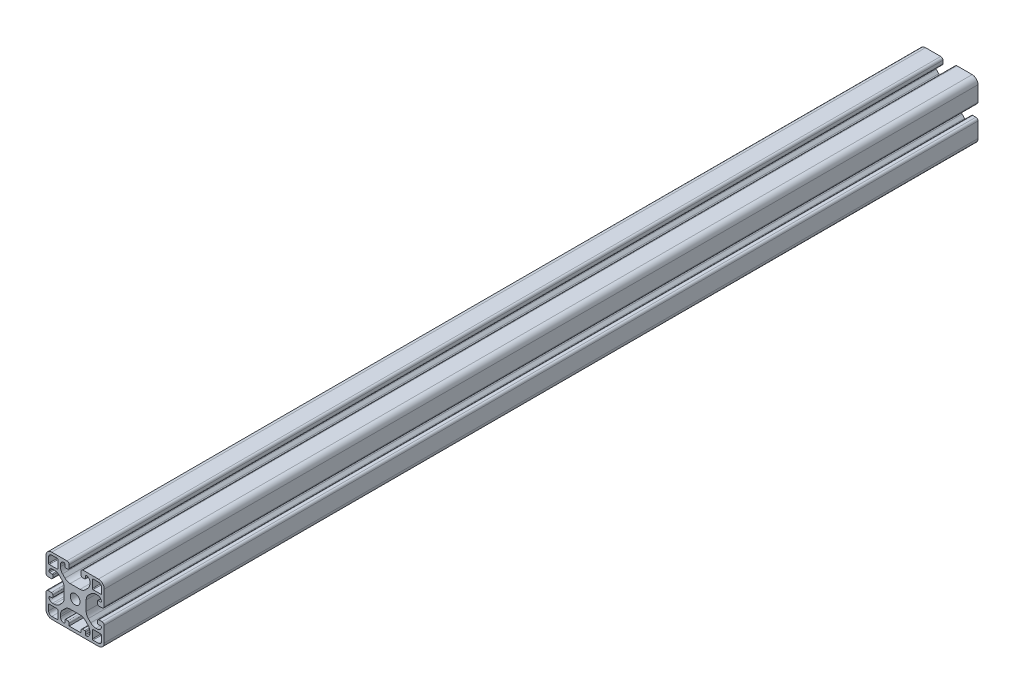
from build123d import *

# Parameters (mm, degrees)
SKIZZE1_R                       = 3.35
AUFSATZ_LINEAR_AUSTRAGEN1_DEPTH = 600
M3_START                        = 1.9e-08
M3_GEWINDEBOHRUNG1_OUTLINE_R    = 1.25
M3_GEWINDEBOHRUNG1_DEPTH        = 27.59999999


# Read off the part's stored shape, not the designer's step: M3 Gewindebohrung1
with BuildPart() as part:
    # Skizze1 → Aufsatz-Linear austragen1 (new body)
    with BuildSketch(Plane.XY.offset(1000)):
        with BuildLine():
            Line((5.899999985, 34.292388165), (5.899999985, 35.500000003))
            ThreePointArc((5.899999985, 35.500000003), (6.632233037, 37.267766961), (8.399999999, 38.000000003))
            ThreePointArc((8.399999999, 38.000000003), (8.753553388, 37.853553393), (8.899999996, 37.500000003))
            Line((8.899999996, 37.500000003), (8.899999996, 35.850000004))
            ThreePointArc((8.899999996, 35.850000004), (9.046446605, 35.496446613), (9.399999996, 35.350000004))
            Line((9.399999996, 35.350000004), (10.899999947, 35.350000004))
            ThreePointArc((10.899999947, 35.350000004), (11.607106728, 35.642893223), (11.899999947, 36.350000004))
            Line((11.899999947, 36.350000004), (11.899999947, 38.500000016))
            ThreePointArc((11.899999947, 38.500000016), (11.460660119, 39.560660188), (10.399999947, 40.000000016))
            Line((10.399999947, 40.000000016), (5.2e-08, 40.000000016))
            ThreePointArc((5.2e-08, 40.000000016), (-2.828427117, 38.828427123), (-4.000000011, 35.999999954))
            Line((-4.000000011, 35.999999954), (-4.000000011, 25.599999996))
            ThreePointArc((-4.000000011, 25.599999996), (-3.560660183, 24.539339825), (-2.500000012, 24.099999997))
            Line((-2.500000012, 24.099999997), (-0.350000011, 24.099999997))
            ThreePointArc((-0.350000011, 24.099999997), (0.35710677, 24.392893216), (0.649999989, 25.099999997))
            Line((0.649999989, 25.099999997), (0.649999989, 26.599999997))
            ThreePointArc((0.649999989, 26.599999997), (0.50355338, 26.953553387), (0.149999989, 27.099999997))
            Line((0.149999989, 27.099999997), (-1.500000011, 27.099999997))
            ThreePointArc((-1.500000011, 27.099999997), (-1.853553401, 27.246446605), (-2.000000011, 27.599999993))
            ThreePointArc((-2.000000011, 27.599999993), (-1.26776697, 29.367766957), (0.499999989, 30.10000001))
            Line((0.499999989, 30.10000001), (1.707611833, 30.10000001))
            ThreePointArc((1.707611833, 30.10000001), (3.621028995, 29.719397673), (5.243145739, 28.635533916))
            Line((5.243145739, 28.635533916), (6.935533894, 26.943145761))
            ThreePointArc((6.935533894, 26.943145761), (8.01939765, 25.321029017), (8.399999988, 23.407611855))
            Line((8.399999988, 23.407611855), (8.399999988, 16.592388122))
            ThreePointArc((8.399999988, 16.592388122), (8.01939765, 14.678970961), (6.935533894, 13.056854217))
            Line((6.935533894, 13.056854217), (5.243145737, 11.36446606))
            ThreePointArc((5.243145737, 11.36446606), (3.621028993, 10.280602303), (1.707611831, 9.899999966))
            Line((1.707611831, 9.899999966), (0.49999999, 9.899999966))
            ThreePointArc((0.49999999, 9.899999966), (-1.267766968, 10.632233018), (-2.00000001, 12.399999979))
            ThreePointArc((-2.00000001, 12.399999979), (-1.8535534, 12.753553368), (-1.50000001, 12.899999977))
            Line((-1.50000001, 12.899999977), (0.149999989, 12.899999977))
            ThreePointArc((0.149999989, 12.899999977), (0.50355338, 13.046446586), (0.649999989, 13.399999977))
            Line((0.649999989, 13.399999977), (0.649999989, 14.899999976))
            ThreePointArc((0.649999989, 14.899999976), (0.35710677, 15.607106757), (-0.350000011, 15.899999976))
            Line((-0.350000011, 15.899999976), (-2.50000001, 15.899999976))
            ThreePointArc((-2.50000001, 15.899999976), (-3.560660182, 15.460660148), (-4.000000011, 14.399999976))
            Line((-4.000000011, 14.399999976), (-4.000000011, 4.000000069))
            ThreePointArc((-4.000000011, 4.000000069), (-2.828427121, 1.171572909), (4e-08, 1.9e-08))
            Line((4e-08, 1.9e-08), (31.999999925, 1.9e-08))
            ThreePointArc((31.999999925, 1.9e-08), (34.828427086, 1.171572909), (35.999999976, 4.00000007))
            Line((35.999999976, 4.00000007), (35.999999976, 14.399999977))
            ThreePointArc((35.999999976, 14.399999977), (35.560660149, 15.460660148), (34.499999978, 15.899999976))
            Line((34.499999978, 15.899999976), (32.349999991, 15.899999976))
            ThreePointArc((32.349999991, 15.899999976), (31.642893209, 15.607106757), (31.34999999, 14.899999976))
            Line((31.34999999, 14.899999976), (31.34999999, 13.399999977))
            ThreePointArc((31.34999999, 13.399999977), (31.4964466, 13.046446586), (31.84999999, 12.899999977))
            Line((31.84999999, 12.899999977), (33.499999991, 12.899999977))
            ThreePointArc((33.499999991, 12.899999977), (33.853553381, 12.753553368), (33.999999991, 12.399999979))
            ThreePointArc((33.999999991, 12.399999979), (33.267766949, 10.632233018), (31.499999991, 9.899999966))
            Line((31.499999991, 9.899999966), (30.292388185, 9.899999966))
            ThreePointArc((30.292388185, 9.899999966), (28.378971023, 10.280602303), (26.756854279, 11.36446606))
            Line((26.756854279, 11.36446606), (25.064466082, 13.056854257))
            ThreePointArc((25.064466082, 13.056854257), (23.980602325, 14.678971001), (23.599999988, 16.592388163))
            Line((23.599999988, 16.592388163), (23.599999988, 23.407611842))
            ThreePointArc((23.599999988, 23.407611842), (23.980602325, 25.321029004), (25.064466082, 26.943145747))
            Line((25.064466082, 26.943145747), (26.75685425, 28.635533916))
            ThreePointArc((26.75685425, 28.635533916), (28.378970995, 29.719397673), (30.292388156, 30.10000001))
            Line((30.292388156, 30.10000001), (31.499999989, 30.10000001))
            ThreePointArc((31.499999989, 30.10000001), (33.267766948, 29.367766957), (33.999999989, 27.599999993))
            ThreePointArc((33.999999989, 27.599999993), (33.853553379, 27.246446605), (33.499999989, 27.099999997))
            Line((33.499999989, 27.099999997), (31.84999999, 27.099999997))
            ThreePointArc((31.84999999, 27.099999997), (31.4964466, 26.953553387), (31.34999999, 26.599999997))
            Line((31.34999999, 26.599999997), (31.34999999, 25.099999997))
            ThreePointArc((31.34999999, 25.099999997), (31.642893209, 24.392893216), (32.34999999, 24.099999997))
            Line((32.34999999, 24.099999997), (34.499999976, 24.099999997))
            ThreePointArc((34.499999976, 24.099999997), (35.560660148, 24.539339825), (35.999999976, 25.599999997))
            Line((35.999999976, 25.599999997), (35.999999976, 35.999999953))
            ThreePointArc((35.999999976, 35.999999953), (34.828427083, 38.828427123), (31.999999914, 40.000000016))
            Line((31.999999914, 40.000000016), (21.600000015, 40.000000016))
            ThreePointArc((21.600000015, 40.000000016), (20.539339844, 39.560660188), (20.100000016, 38.500000017))
            Line((20.100000016, 38.500000017), (20.100000016, 36.350000004))
            ThreePointArc((20.100000016, 36.350000004), (20.392893235, 35.642893223), (21.100000017, 35.350000004))
            Line((21.100000017, 35.350000004), (22.600000014, 35.350000004))
            ThreePointArc((22.600000014, 35.350000004), (22.953553405, 35.496446613), (23.100000014, 35.850000004))
            Line((23.100000014, 35.850000004), (23.100000014, 37.500000007))
            ThreePointArc((23.100000014, 37.500000007), (23.246446625, 37.8535534), (23.600000019, 38.000000007))
            ThreePointArc((23.600000019, 38.000000007), (25.367766955, 37.267766951), (26.099999992, 35.500000007))
            Line((26.099999992, 35.500000007), (26.099999992, 34.292388127))
            ThreePointArc((26.099999992, 34.292388127), (25.719397655, 32.378970966), (24.635533898, 30.756854221))
            Line((24.635533898, 30.756854221), (22.943145779, 29.064466103))
            ThreePointArc((22.943145779, 29.064466103), (21.321029035, 27.980602346), (19.407611873, 27.600000009))
            Line((19.407611873, 27.600000009), (12.592388142, 27.600000009))
            ThreePointArc((12.592388142, 27.600000009), (10.678970981, 27.980602346), (9.056854237, 29.064466102))
            Line((9.056854237, 29.064466102), (7.36446608, 30.75685426))
            ThreePointArc((7.36446608, 30.75685426), (6.280602323, 32.378971004), (5.899999985, 34.292388165))
        make_face()
        with Locations(Location((15.999999985, 20, 0), (0, 0, 180))):
            Circle(SKIZZE1_R, mode=Mode.SUBTRACT)
        with BuildLine():
            Line((27.799999996, 32.299999708), (27.799999996, 37.700000083))
            ThreePointArc((27.799999996, 37.700000083), (27.946446591, 38.053553439), (28.299999947, 38.200000034))
            Line((28.299999947, 38.200000034), (31.999999914, 38.200000034))
            ThreePointArc((31.999999914, 38.200000034), (33.555634889, 37.555634929), (34.199999994, 35.999999953))
            Line((34.199999994, 35.999999953), (34.199999994, 32.300000046))
            ThreePointArc((34.199999994, 32.300000046), (34.053553382, 31.946446648), (33.699999983, 31.800000035))
            Line((33.699999983, 31.800000035), (28.299999669, 31.800000035))
            ThreePointArc((28.299999669, 31.800000035), (27.94644651, 31.946446549), (27.799999996, 32.299999708))
        make_face(mode=Mode.SUBTRACT)
        with BuildLine():
            Line((28.299999669, 8.199999998), (33.700000043, 8.199999998))
            ThreePointArc((33.700000043, 8.199999998), (34.053553399, 8.053553402), (34.199999994, 7.700000046))
            Line((34.199999994, 7.700000046), (34.199999994, 4.00000007))
            ThreePointArc((34.199999994, 4.00000007), (33.555634893, 2.444365103), (31.999999925, 1.800000001))
            Line((31.999999925, 1.800000001), (28.300000007, 1.800000001))
            ThreePointArc((28.300000007, 1.800000001), (27.946446609, 1.946446613), (27.799999996, 2.300000012))
            Line((27.799999996, 2.300000012), (27.799999996, 7.700000324))
            ThreePointArc((27.799999996, 7.700000324), (27.94644651, 8.053553484), (28.299999669, 8.199999998))
        make_face(mode=Mode.SUBTRACT)
        with BuildLine():
            Line((3.700000285, 31.800000035), (-1.700000077, 31.800000035))
            ThreePointArc((-1.700000077, 31.800000035), (-2.053553433, 31.94644663), (-2.200000029, 32.299999986))
            Line((-2.200000029, 32.299999986), (-2.200000029, 35.999999954))
            ThreePointArc((-2.200000029, 35.999999954), (-1.555634924, 37.555634929), (5.2e-08, 38.200000034))
            Line((5.2e-08, 38.200000034), (3.699999947, 38.200000034))
            ThreePointArc((3.699999947, 38.200000034), (4.053553346, 38.053553422), (4.199999959, 37.700000023))
            Line((4.199999959, 37.700000023), (4.199999959, 32.299999708))
            ThreePointArc((4.199999959, 32.299999708), (4.053553445, 31.946446549), (3.700000285, 31.800000035))
        make_face(mode=Mode.SUBTRACT)
        with BuildLine():
            Line((4.199999959, 7.700000324), (4.199999959, 2.299999952))
            ThreePointArc((4.199999959, 2.299999952), (4.053553363, 1.946446596), (3.700000007, 1.800000001))
            Line((3.700000007, 1.800000001), (4e-08, 1.800000001))
            ThreePointArc((4e-08, 1.800000001), (-1.555634927, 2.444365102), (-2.200000029, 4.000000069))
            Line((-2.200000029, 4.000000069), (-2.200000029, 7.699999986))
            ThreePointArc((-2.200000029, 7.699999986), (-2.053553416, 8.053553385), (-1.700000017, 8.199999998))
            Line((-1.700000017, 8.199999998), (3.700000285, 8.199999998))
            ThreePointArc((3.700000285, 8.199999998), (4.053553445, 8.053553484), (4.199999959, 7.700000324))
        make_face(mode=Mode.SUBTRACT)
        with BuildLine():
            Line((20.100000016, 2.000000008), (11.899999947, 2.000000008))
            Line((11.899999947, 2.000000008), (11.899999947, 3.649999992))
            ThreePointArc((11.899999947, 3.649999992), (11.607106728, 4.357106773), (10.899999947, 4.649999992))
            Line((10.899999947, 4.649999992), (9.399999996, 4.649999992))
            ThreePointArc((9.399999996, 4.649999992), (9.046446606, 4.503553382), (8.899999996, 4.149999992))
            Line((8.899999996, 4.149999992), (8.899999996, 2.499999991))
            ThreePointArc((8.899999996, 2.499999991), (8.753553389, 2.146446604), (8.400000003, 1.999999994))
            ThreePointArc((8.400000003, 1.999999994), (6.632233039, 2.732233035), (5.899999985, 4.499999994))
            Line((5.899999985, 4.499999994), (5.899999985, 5.707611838))
            ThreePointArc((5.899999985, 5.707611838), (6.280602323, 7.621029001), (7.36446608, 9.243145746))
            Line((7.36446608, 9.243145746), (9.056854238, 10.935533903))
            ThreePointArc((9.056854238, 10.935533903), (10.678970982, 12.01939766), (12.592388143, 12.399999997))
            Line((12.592388143, 12.399999997), (19.407611847, 12.399999997))
            ThreePointArc((19.407611847, 12.399999997), (21.321029008, 12.01939766), (22.943145752, 10.935533904))
            Line((22.943145752, 10.935533904), (24.635533898, 9.243145757))
            ThreePointArc((24.635533898, 9.243145757), (25.719397655, 7.621029013), (26.099999992, 5.707611851))
            Line((26.099999992, 5.707611851), (26.099999992, 4.499999993))
            ThreePointArc((26.099999992, 4.499999993), (25.367766954, 2.73223305), (23.600000019, 1.999999995))
            ThreePointArc((23.600000019, 1.999999995), (23.246446625, 2.146446603), (23.100000014, 2.499999995))
            Line((23.100000014, 2.499999995), (23.100000014, 4.149999994))
            ThreePointArc((23.100000014, 4.149999994), (22.953553405, 4.503553383), (22.600000016, 4.649999992))
            Line((22.600000016, 4.649999992), (21.100000017, 4.649999992))
            ThreePointArc((21.100000017, 4.649999992), (20.392893235, 4.357106773), (20.100000016, 3.649999992))
            Line((20.100000016, 3.649999992), (20.100000016, 2.000000008))
        make_face(mode=Mode.SUBTRACT)
    extrude(amount=-AUFSATZ_LINEAR_AUSTRAGEN1_DEPTH)

    # M3 Gewindebohrung1 outline → M3 Gewindebohrung1 (cut)
    with BuildSketch(Plane(origin=(0, 0, 0), x_dir=(1, 0, 0), z_dir=(0, 1, 0)).offset(M3_START)):
        with Locations((15.999999982, -450)):
            Circle(M3_GEWINDEBOHRUNG1_OUTLINE_R)
        with Locations((15.999999982, -475)):
            Circle(M3_GEWINDEBOHRUNG1_OUTLINE_R)
        with Locations((15.999999982, -500)):
            Circle(M3_GEWINDEBOHRUNG1_OUTLINE_R)
        with Locations((15.999999982, -525)):
            Circle(M3_GEWINDEBOHRUNG1_OUTLINE_R)
        with Locations((15.999999982, -550)):
            Circle(M3_GEWINDEBOHRUNG1_OUTLINE_R)
        with Locations((15.999999982, -575)):
            Circle(M3_GEWINDEBOHRUNG1_OUTLINE_R)
        with Locations((15.999999982, -600)):
            Circle(M3_GEWINDEBOHRUNG1_OUTLINE_R)
        with Locations((15.999999982, -625)):
            Circle(M3_GEWINDEBOHRUNG1_OUTLINE_R)
        with Locations((15.999999982, -650)):
            Circle(M3_GEWINDEBOHRUNG1_OUTLINE_R)
        with Locations((15.999999982, -675)):
            Circle(M3_GEWINDEBOHRUNG1_OUTLINE_R)
        with Locations((15.999999982, -700)):
            Circle(M3_GEWINDEBOHRUNG1_OUTLINE_R)
        with Locations((15.999999982, -725)):
            Circle(M3_GEWINDEBOHRUNG1_OUTLINE_R)
        with Locations((15.999999982, -750)):
            Circle(M3_GEWINDEBOHRUNG1_OUTLINE_R)
        with Locations((15.999999982, -775)):
            Circle(M3_GEWINDEBOHRUNG1_OUTLINE_R)
        with Locations((15.999999982, -800)):
            Circle(M3_GEWINDEBOHRUNG1_OUTLINE_R)
        with Locations((15.999999982, -825)):
            Circle(M3_GEWINDEBOHRUNG1_OUTLINE_R)
        with Locations((15.999999982, -850)):
            Circle(M3_GEWINDEBOHRUNG1_OUTLINE_R)
        with Locations((15.999999982, -875)):
            Circle(M3_GEWINDEBOHRUNG1_OUTLINE_R)
        with Locations((15.999999982, -900)):
            Circle(M3_GEWINDEBOHRUNG1_OUTLINE_R)
        with Locations((15.999999982, -925)):
            Circle(M3_GEWINDEBOHRUNG1_OUTLINE_R)
        with Locations((15.999999982, -950)):
            Circle(M3_GEWINDEBOHRUNG1_OUTLINE_R)
    extrude(amount=M3_GEWINDEBOHRUNG1_DEPTH, mode=Mode.SUBTRACT)


solid = part.part
